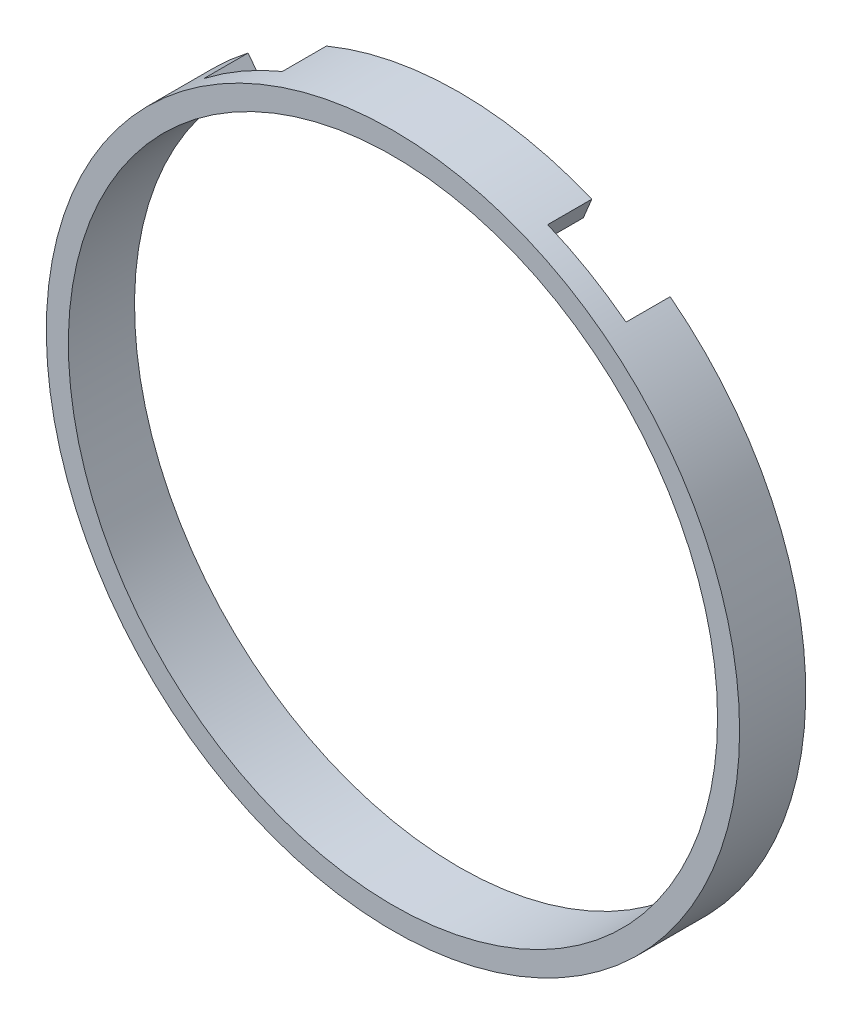
from build123d import *

# Parameters (mm, degrees)
SKETCH1_R           = 24.9555
SKETCH1_R_2         = 23.368
BOSS_EXTRUDE1_DEPTH = 4.7625
CUT_EXTRUDE1_DEPTH  = 3.175


with BuildPart() as part:
    # Sketch1 → Boss-Extrude1 (new body)
    with BuildSketch(Plane.XY):
        Circle(SKETCH1_R)
        Circle(SKETCH1_R_2, mode=Mode.SUBTRACT)
    extrude(amount=BOSS_EXTRUDE1_DEPTH)

    # Sketch2 → Cut-Extrude1 (cut)
    with BuildSketch(Plane(origin=(0, 0, 0), x_dir=(-1, 0, 0), z_dir=(0, 0, -1))):
        with BuildLine():
            Line((9.550056396, 23.055875674), (8.942546448, 21.589216916))
            ThreePointArc((8.942546448, 21.589216916), (11.684, 20.237281636), (14.225537073, 18.539080856))
            Line((14.225537073, 18.539080856), (15.191945842, 19.798529284))
            ThreePointArc((15.191945842, 19.798529284), (12.47775, 21.612096964), (9.550056396, 23.055875674))
        make_face()
    cut_extrude1 = extrude(amount=-CUT_EXTRUDE1_DEPTH, mode=Mode.SUBTRACT)

    # Mirror1: Cut-Extrude1 across plane
    add(cut_extrude1.mirror(Plane(origin=(0, 0, 0), x_dir=(0, 0, 1), z_dir=(1, 0, 0))), mode=Mode.SUBTRACT)


solid = part.part
